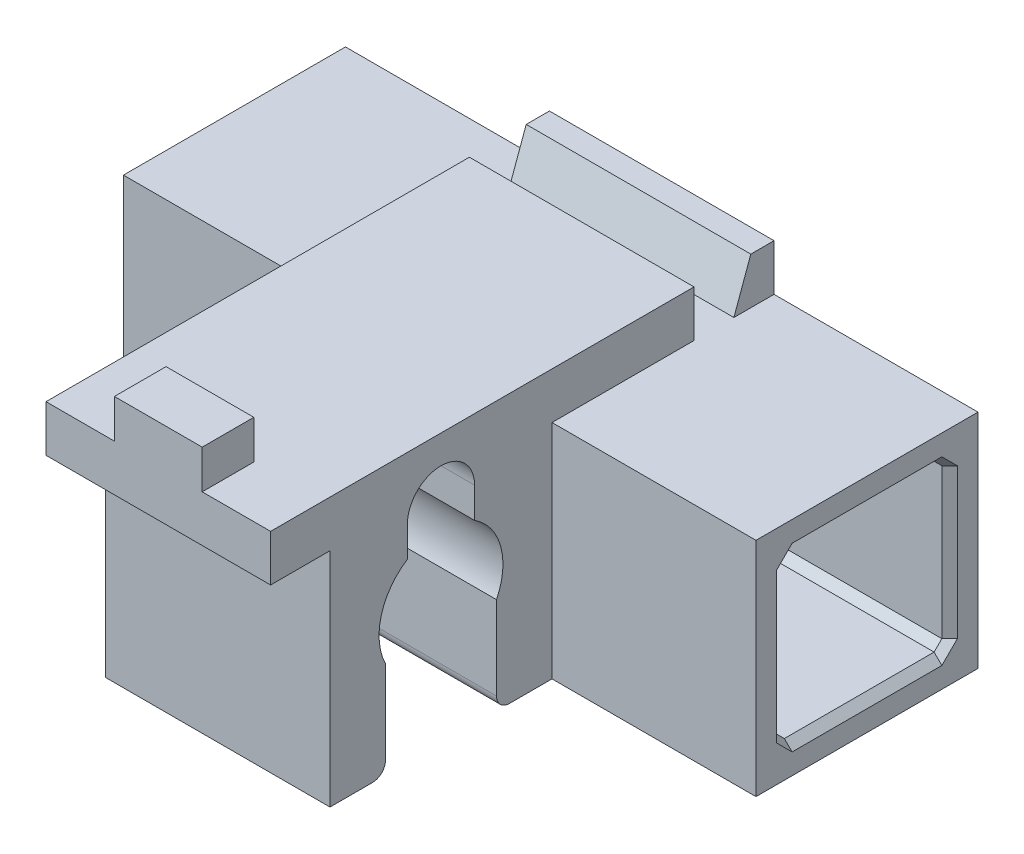
from build123d import *

# Parameters (mm, degrees)
SKETCH2_W           = 8.6
SKETCH2_H           = 8.6
SKETCH2_W_2         = 6.4
SKETCH2_H_2         = 6.4
EXTRUDE_THIN1_DEPTH = 12.25
CHAMFER1_SIZE       = 0.3
BOSS_EXTRUDE1_START = -12.25
SKETCH3_W           = 0.6
SKETCH3_H           = 2.2
BOSS_EXTRUDE1_DEPTH = 5
SKETCH4_W           = 8.7
SKETCH4_H           = 1.8
BOSS_EXTRUDE2_DEPTH = 19.5
CUT_EXTRUDE1_REACH  = 25.32
SKETCH5_W           = 1.5
SKETCH5_H           = 1.8
CHAMFER2_SIZE       = 0.7
CHAMFER2_SIZE_2     = 1.923234194
SKETCH6_W           = 3.4
SKETCH6_H           = 1.5
BOSS_EXTRUDE3_DEPTH = 2
BOSS_EXTRUDE4_DEPTH = 8.7
CUT_EXTRUDE2_REACH  = 25.756
FILLET1_R           = 0.5
SKETCH8_W           = 4
SKETCH8_H           = 4.4
SKETCH8_W_2         = 2.6
SKETCH8_H_2         = 3
SKETCH8_W_3         = 8.4
SKETCH8_H_3         = 0.5
CUT_EXTRUDE3_DEPTH  = 0.3


with BuildPart() as part:
    # Sketch2 → Extrude-Thin1 (new, symmetric)
    with BuildSketch(Plane(origin=(0, 0, 0), x_dir=(0, 0, -1), z_dir=(1, 0, 0))):
        Rectangle(SKETCH2_W, SKETCH2_H)
        Rectangle(SKETCH2_W_2, SKETCH2_H_2, mode=Mode.SUBTRACT)
    extrude(amount=EXTRUDE_THIN1_DEPTH, both=True)

    # Chamfer1
    chamfer1_edges = [part.edges().sort_by_distance(p)[0] for p in [
        (-12.25, 0, -3.2),
        (0, -3.2, -3.2),
        (-12.25, 3.2, 0),
        (0, 3.2, -3.2),
        (-12.25, 0, 3.2),
        (0, 3.2, 3.2),
        (-12.25, -3.2, 0),
        (0, -3.2, 3.2),
        (12.25, 0, -3.2),
        (12.25, 3.2, 0),
        (12.25, 0, 3.2),
        (12.25, -3.2, 0),
    ]]
    chamfer(chamfer1_edges, length=CHAMFER1_SIZE)

    # Sketch3 → Boss-Extrude1 (add, symmetric)
    with BuildSketch(Plane(origin=(12.25, 0, 0), x_dir=(0, 0, -1), z_dir=(1, 0, 0)).offset(BOSS_EXTRUDE1_START)):
        with Locations((-1.891287847, 2.1)):
            Rectangle(SKETCH3_W, SKETCH3_H)
        with Locations((-1.891287847, -2.1)):
            Rectangle(SKETCH3_W, SKETCH3_H)
    extrude(amount=BOSS_EXTRUDE1_DEPTH, both=True)

    # Sketch4 → Boss-Extrude2 (add)
    with BuildSketch(Plane(origin=(0, 0, -4.3), x_dir=(-1, 0, 0), z_dir=(0, 0, -1))):
        with Locations((0, 5.2)):
            Rectangle(SKETCH4_W, SKETCH4_H)
    extrude(amount=-BOSS_EXTRUDE2_DEPTH)

    # Sketch5 → Cut-Extrude1 (cut, up to next)
    with BuildSketch(Plane(origin=(4.35, 0, 0), x_dir=(0, 0, -1), z_dir=(1, 0, 0)), mode=Mode.PRIVATE) as cut_extrude1_sk1:
        with Locations((1.95, 5.2)):
            Rectangle(SKETCH5_W, SKETCH5_H)
    cut_extrude1_tool1 = extrude(cut_extrude1_sk1.sketch, amount=-CUT_EXTRUDE1_REACH, mode=Mode.PRIVATE) & part.part
    add(cut_extrude1_tool1.solids().sort_by_distance((4.35, 5.2, -1.95))[0], mode=Mode.SUBTRACT)

    # Chamfer2
    # the kernel refuses this chamfer: 1.923234194, 0.7 mm, written as the material it takes off along each edge
    with BuildSketch(Plane(origin=(9.339244015, 6.1, -2.7), x_dir=(0, 0.09904090225205073, -0.9950833631817486), z_dir=(-1, 0, 0))) as chamfer2_piece_1_section:
        Polygon((CHAMFER2_SIZE * 0.995083363182, CHAMFER2_SIZE * 0.0990409022521), (-CHAMFER2_SIZE_2 * 0.0990409022324, CHAMFER2_SIZE_2 * 0.995083362984), (0, 0), align=None)
    chamfer2_piece_1 = extrude(amount=18.678488029, mode=Mode.PRIVATE)
    chamfer2_piece_1 = split(chamfer2_piece_1, bisect_by=Plane(origin=(0, 4.3, -2.919451718), z_dir=(0, 1, 0)), keep=Keep.TOP, mode=Mode.PRIVATE)
    add(chamfer2_piece_1, mode=Mode.SUBTRACT)

    # Sketch6 → Boss-Extrude3 (add)
    with BuildSketch(Plane.XY.offset(15.2)):
        with Locations((0, 6.85)):
            Rectangle(SKETCH6_W, SKETCH6_H)
    extrude(amount=-BOSS_EXTRUDE3_DEPTH)

    # Sketch7 → Boss-Extrude4 (add)
    with BuildSketch(Plane(origin=(4.35, 0, 0), x_dir=(0, 0, -1), z_dir=(1, 0, 0))):
        with BuildLine():
            ThreePointArc((-9.9, 3.7), (-9.862781283, 4.008842082), (-9.753256259, 4.3))
            Line((-9.753256259, 4.3), (-12.9, 4.3))
            Line((-12.9, 4.3), (-12.9, -4.3))
            Line((-12.9, -4.3), (-10.75, -4.3))
            Line((-10.75, -4.3), (-10.75, -0.56653645))
            ThreePointArc((-10.75, -0.56653645), (-10.913726036, 1.137708265), (-9.9, 2.5174241))
            Line((-9.9, 2.5174241), (-9.9, 3.7))
        make_face()
        with BuildLine():
            Line((-4.3, -4.3), (-4.3, 4.3))
            Line((-4.3, 4.3), (-7.446743741, 4.3))
            ThreePointArc((-7.446743741, 4.3), (-7.337218717, 4.008842082), (-7.3, 3.7))
            Line((-7.3, 3.7), (-7.3, 2.5174241))
            ThreePointArc((-7.3, 2.5174241), (-6.492869249, 1.648912529), (-6.2, 0.5))
            ThreePointArc((-6.2, 0.5), (-6.263335711, -0.047722558), (-6.45, -0.56653645))
            Line((-6.45, -0.56653645), (-6.45, -4.3))
            Line((-6.45, -4.3), (-4.3, -4.3))
        make_face()
    extrude(amount=-BOSS_EXTRUDE4_DEPTH)

    # Sketch7<3> → Cut-Extrude2 (cut, up to next)
    with BuildSketch(Plane(origin=(4.35, 0, 0), x_dir=(0, 0, -1), z_dir=(1, 0, 0)), mode=Mode.PRIVATE) as cut_extrude2_sk1:
        with BuildLine():
            Line((-9.753256259, 4.3), (-7.446743741, 4.3))
            ThreePointArc((-7.446743741, 4.3), (-8.6, 5), (-9.753256259, 4.3))
        make_face()
    cut_extrude2_tool1 = extrude(cut_extrude2_sk1.sketch, amount=-CUT_EXTRUDE2_REACH, mode=Mode.PRIVATE) & part.part
    add(cut_extrude2_tool1.solids().sort_by_distance((4.35, 4.587672, 8.6))[0], mode=Mode.SUBTRACT)

    # Fillet1
    fillet1_edges = [part.edges().sort_by_distance(p)[0] for p in [
        (0, -4.3, 10.75),
        (0, -4.3, 6.45),
    ]]
    fillet(fillet1_edges, radius=FILLET1_R)

    # Sketch8 → Cut-Extrude3 (cut)
    # profile 1 of 4: a face of its own
    with BuildSketch(Plane(origin=(0, 0, -4.3), x_dir=(-1, 0, 0), z_dir=(0, 0, -1))):
        with Locations((-6.2, 1.1)):
            Rectangle(SKETCH8_W, SKETCH8_H)
        with Locations((-6.2, 1.1)):
            Rectangle(SKETCH8_W_2, SKETCH8_H_2, mode=Mode.SUBTRACT)
    # profile 2 of 4: a face of its own
    with BuildSketch(Plane(origin=(0, 0, -4.3), x_dir=(-1, 0, 0), z_dir=(0, 0, -1))):
        with Locations((0, 2.05)):
            Rectangle(SKETCH8_W_3, SKETCH8_H_3)
    # profile 3 of 4: a face of its own
    with BuildSketch(Plane(origin=(0, 0, -4.3), x_dir=(-1, 0, 0), z_dir=(0, 0, -1))):
        with Locations((0, 0.15)):
            Rectangle(SKETCH8_W_3, SKETCH8_H_3)
    # profile 4 of 4: a face of its own
    with BuildSketch(Plane(origin=(0, 0, -4.3), x_dir=(-1, 0, 0), z_dir=(0, 0, -1))):
        with Locations((6.2, 1.1)):
            Rectangle(SKETCH8_W, SKETCH8_H)
        with Locations((6.2, 1.1)):
            Rectangle(SKETCH8_W_2, SKETCH8_H_2, mode=Mode.SUBTRACT)
    extrude(amount=-CUT_EXTRUDE3_DEPTH, mode=Mode.SUBTRACT)


solid = part.part
